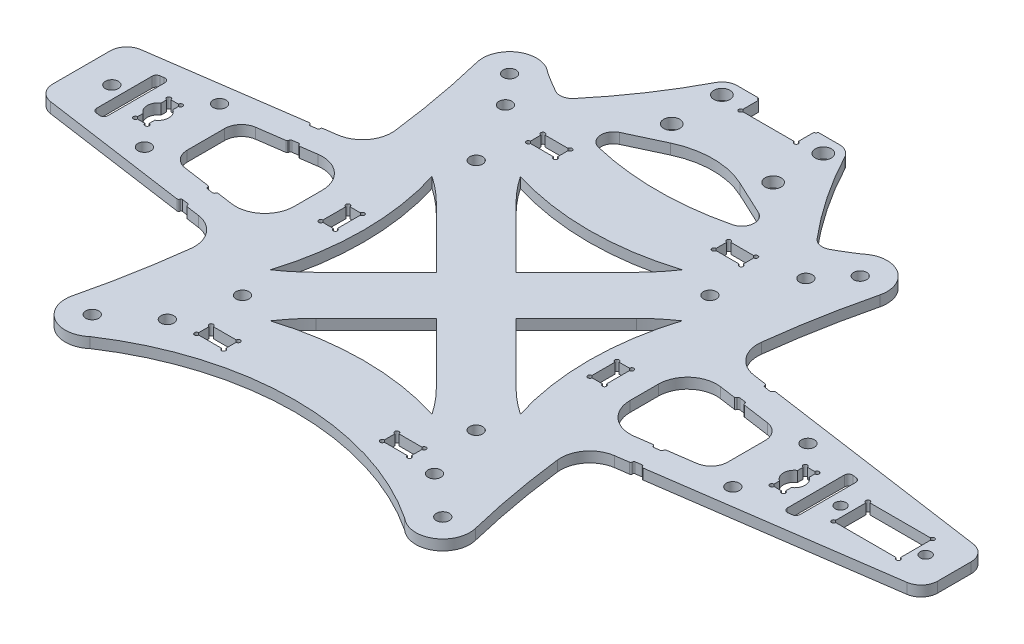
from build123d import *

# Parameters (mm, degrees)
SKETCH_1_R             = 1.55
SKETCH_1_R_2           = 1.3
SKETCH_1_W             = 6.5
SKETCH_1_H             = 3.5
SKETCH_1_W_2           = 3.5
SKETCH_1_H_2           = 6.5
SKETCH_1_W_3           = 15.5
SKETCH_1_H_3           = 8.2
EXTRUDE_1_DEPTH        = 2.5
FILLET_1_R             = 4
FILLET_2_R             = 7
CUT_EXTRUDE_3_DEPTH    = 128.770204339
FILLET_5_R             = 0.35
FILLET_4_R             = 1
SKETCH_6823_R          = 1.55
SKETCH_6823_R_2        = 1.925
EXTRUDE_2_DEPTH        = 2.5
SKETCH_10_R            = 0.5
CUT_EXTRUDE_6_DEPTH    = 137.857877785
SKETCH_11_R            = 1.55
CUT_EXTRUDE_9096_DEPTH = 137.857877785
FILLET_6_R             = 3


with BuildPart() as part:
    # 草图1 → 凸台-拉伸1 (new body)
    with BuildSketch(Plane(origin=(0, 0, 0), x_dir=(1, 0, 0), z_dir=(0, 1, 0))):
        with BuildLine():
            Line((114.591143215, 7.468307572), (114.591143215, -7.468307572))
            Line((114.591143215, -7.468307572), (43.193640968, -17.646273029))
            ThreePointArc((43.193640968, -17.646273029), (45.143245402, -33.15226541), (48.27557779, -48.463217404))
            ThreePointArc((48.27557779, -48.463217404), (45.335063646, -55.533708325), (37.709796983, -54.831018053))
            ThreePointArc((37.709796983, -54.831018053), (0, -43.436211003), (-37.709796983, -54.831018053))
            ThreePointArc((-37.709796983, -54.831018053), (-45.335063646, -55.533708325), (-48.27557779, -48.463217404))
            ThreePointArc((-48.27557779, -48.463217404), (-45.143245402, -33.15226541), (-43.193640968, -17.646273029))
            Line((-43.193640968, -17.646273029), (-94.579518436, -10.321035179))
            Line((-94.579518436, -10.321035179), (-94.579518436, 10.321035179))
            Line((-94.579518436, 10.321035179), (-43.193640968, 17.646273029))
            ThreePointArc((-43.193640968, 17.646273029), (-45.143245402, 33.15226541), (-48.27557779, 48.463217404))
            ThreePointArc((-48.27557779, 48.463217404), (-45.335063646, 55.533708325), (-37.709796983, 54.831018053))
            ThreePointArc((-37.709796983, 54.831018053), (0, 43.436211003), (37.709796983, 54.831018053))
            ThreePointArc((37.709796983, 54.831018053), (45.335063646, 55.533708325), (48.27557779, 48.463217404))
            ThreePointArc((48.27557779, 48.463217404), (45.143245402, 33.15226541), (43.193640968, 17.646273029))
            Line((43.193640968, 17.646273029), (114.591143215, 7.468307572))
        make_face()
        with Locations(Location((-36, 43, 0), (0, 0, 270))):
            Circle(SKETCH_1_R, mode=Mode.SUBTRACT)
        with Locations(Location((-32, -42, 0), (0, 0, 270))):
            Circle(SKETCH_1_R, mode=Mode.SUBTRACT)
        with Locations(Location((32, -42, 0), (0, 0, 90))):
            Circle(SKETCH_1_R, mode=Mode.SUBTRACT)
        with Locations(Location((36, 43, 0), (0, 0, 90))):
            Circle(SKETCH_1_R, mode=Mode.SUBTRACT)
        with Locations(Location((42, 50, 0), (0, 0, 270))):
            Circle(SKETCH_1_R, mode=Mode.SUBTRACT)
        with Locations(Location((42, -50, 0), (0, 0, 90))):
            Circle(SKETCH_1_R, mode=Mode.SUBTRACT)
        with Locations(Location((-42, -50, 0), (0, 0, 270))):
            Circle(SKETCH_1_R, mode=Mode.SUBTRACT)
        with Locations(Location((-42, 50, 0), (0, 0, 90))):
            Circle(SKETCH_1_R, mode=Mode.SUBTRACT)
        with Locations(Location((107.7, 0, 0), (0, 0, 270))):
            Circle(SKETCH_1_R_2, mode=Mode.SUBTRACT)
        with Locations(Location((87.3, 0, 0), (0, 0, 270))):
            Circle(SKETCH_1_R_2, mode=Mode.SUBTRACT)
        with Locations(Location((70.5, 9, 0), (0, 0, 270))):
            Circle(SKETCH_1_R, mode=Mode.SUBTRACT)
        with Locations(Location((70.5, -9, 0), (0, 0, 90))):
            Circle(SKETCH_1_R, mode=Mode.SUBTRACT)
        with Locations(Location((-70.5, -9, 0), (0, 0, 270))):
            Circle(SKETCH_1_R, mode=Mode.SUBTRACT)
        with Locations(Location((-70.5, 9, 0), (0, 0, 90))):
            Circle(SKETCH_1_R, mode=Mode.SUBTRACT)
        with Locations(Location((-87.3, 0, 0), (0, 0, 270))):
            Circle(SKETCH_1_R, mode=Mode.SUBTRACT)
        with Locations((-22.25, 39.75)):
            Rectangle(SKETCH_1_W, SKETCH_1_H, mode=Mode.SUBTRACT)
        with Locations((-32.25, 0)):
            Rectangle(SKETCH_1_W_2, SKETCH_1_H_2, mode=Mode.SUBTRACT)
        with Locations((-22.25, -39.75)):
            Rectangle(SKETCH_1_W, SKETCH_1_H, mode=Mode.SUBTRACT)
        with Locations((22.25, 39.75)):
            Rectangle(SKETCH_1_W, SKETCH_1_H, mode=Mode.SUBTRACT)
        with Locations((22.25, -39.75)):
            Rectangle(SKETCH_1_W, SKETCH_1_H, mode=Mode.SUBTRACT)
        with Locations((32.25, 0)):
            Rectangle(SKETCH_1_W_2, SKETCH_1_H_2, mode=Mode.SUBTRACT)
        with BuildLine():
            Line((77.65, -2.151778405), (77.65, -4))
            Line((77.65, -4), (74.85, -4))
            Line((74.85, -4), (74.85, -2.176778405))
            ThreePointArc((74.85, -2.176778405), (73.652957971, 0), (74.85, 2.176778405))
            Line((74.85, 2.176778405), (74.85, 4))
            Line((74.85, 4), (77.65, 4))
            Line((77.65, 4), (77.65, 2.151778405))
            ThreePointArc((77.65, 2.151778405), (78.8083942, 0), (77.65, -2.151778405))
        make_face(mode=Mode.SUBTRACT)
        with Locations((97.5, 0)):
            Rectangle(SKETCH_1_W_3, SKETCH_1_H_3, mode=Mode.SUBTRACT)
        with BuildLine():
            Line((-74.85, -2.176778405), (-74.85, -4))
            Line((-74.85, -4), (-77.65, -4))
            Line((-77.65, -4), (-77.65, -2.151778405))
            ThreePointArc((-77.65, -2.151778405), (-78.8083942, 0), (-77.65, 2.151778405))
            Line((-77.65, 2.151778405), (-77.65, 4))
            Line((-77.65, 4), (-74.85, 4))
            Line((-74.85, 4), (-74.85, 2.176778405))
            ThreePointArc((-74.85, 2.176778405), (-73.652957971, 0), (-74.85, -2.176778405))
        make_face(mode=Mode.SUBTRACT)
        with BuildLine():
            Line((-23.978041684, 14.429581723), (-9.54845996, 0))
            Line((-9.54845996, 0), (-23.978041684, -14.429581723))
            ThreePointArc((-23.978041684, -14.429581723), (-26.851664039, -17.042325553), (-29.960234119, -19.370614155))
            ThreePointArc((-29.960234119, -19.370614155), (-27.006361348, 0), (-29.960234119, 19.370614155))
            ThreePointArc((-29.960234119, 19.370614155), (-26.851664039, 17.042325553), (-23.978041684, 14.429581723))
        make_face(mode=Mode.SUBTRACT)
        with BuildLine():
            Line((14.429581723, 23.978041684), (0, 9.54845996))
            Line((0, 9.54845996), (-14.429581723, 23.978041684))
            ThreePointArc((-14.429581723, 23.978041684), (-17.042325553, 26.851664039), (-19.370614155, 29.960234119))
            ThreePointArc((-19.370614155, 29.960234119), (0, 27.006361348), (19.370614155, 29.960234119))
            ThreePointArc((19.370614155, 29.960234119), (17.042325553, 26.851664039), (14.429581723, 23.978041684))
        make_face(mode=Mode.SUBTRACT)
        with BuildLine():
            Line((23.978041684, -14.429581723), (9.54845996, 0))
            Line((9.54845996, 0), (23.978041684, 14.429581723))
            ThreePointArc((23.978041684, 14.429581723), (26.851664039, 17.042325553), (29.960234119, 19.370614155))
            ThreePointArc((29.960234119, 19.370614155), (27.006361348, 0), (29.960234119, -19.370614155))
            ThreePointArc((29.960234119, -19.370614155), (26.851664039, -17.042325553), (23.978041684, -14.429581723))
        make_face(mode=Mode.SUBTRACT)
        with BuildLine():
            Line((-14.429581723, -23.978041684), (0, -9.54845996))
            Line((0, -9.54845996), (14.429581723, -23.978041684))
            ThreePointArc((14.429581723, -23.978041684), (17.042325553, -26.851664039), (19.370614155, -29.960234119))
            ThreePointArc((19.370614155, -29.960234119), (0, -27.006361348), (-19.370614155, -29.960234119))
            ThreePointArc((-19.370614155, -29.960234119), (-17.042325553, -26.851664039), (-14.429581723, -23.978041684))
        make_face(mode=Mode.SUBTRACT)
        Polygon((-64.75, -7.957119899), (-64.75, 7.957119899), (-40.25, 11.449681205), (-40.25, -11.449681205), align=None, mode=Mode.SUBTRACT)
        Polygon((64.75, 7.957119899), (40.25, 11.449681205), (40.25, -11.449681205), (64.75, -7.957119899), align=None, mode=Mode.SUBTRACT)
        Polygon((84.3, 7.543714683), (81.4, 7.957119899), (81.4, -7.957119899), (84.3, -7.543714683), align=None, mode=Mode.SUBTRACT)
        Polygon((-84.3, 7.543714683), (-84.3, -7.543714683), (-81.4, -7.957119899), (-81.4, 7.957119899), align=None, mode=Mode.SUBTRACT)
    extrude(amount=EXTRUDE_1_DEPTH)

    # 圆角1
    fillet_1_edges = [part.edges().sort_by_distance(p)[0] for p in [
        (-64.75, 1.25, -7.957119899),
        (-64.75, 1.25, 7.957119899),
        (64.75, 1.25, 7.957119899),
        (64.75, 1.25, -7.957119899),
        (114.591143215, 1.25, -7.468307572),
        (114.591143215, 1.25, 7.468307572),
        (-94.579518436, 1.25, 10.321035179),
        (-94.579518436, 1.25, -10.321035179),
    ]]
    fillet(fillet_1_edges, radius=FILLET_1_R)

    # 圆角2
    fillet_2_edges = [part.edges().sort_by_distance(p)[0] for p in [
        (-40.25, 1.25, -11.449681205),
        (-40.25, 1.25, 11.449681205),
        (40.25, 1.25, -11.449681205),
        (40.25, 1.25, 11.449681205),
        (-43.193640968, 1.25, -17.646273029),
        (43.193640968, 1.25, -17.646273029),
        (43.193640968, 1.25, 17.646273029),
        (-43.193640968, 1.25, 17.646273029),
    ]]
    fillet(fillet_2_edges, radius=FILLET_2_R)

    # 草图6 → 切除-拉伸3 (cut, through all)
    with BuildSketch(Plane(origin=(0, 2.5, 0), x_dir=(1, 0, 0), z_dir=(0, 1, 0))):
        Polygon((53.295953363, 16.20615281), (55.637277294, 15.872388836), (55.245478476, 15.271669864), (53.295953363, 15.549581537), align=None)
        Polygon((54.504562879, 10.074214326), (52.555037767, 10.352125998), (52.371572952, 9.72170828), (54.712896883, 9.387944306), align=None)
        Polygon((52.555037767, -10.352125998), (52.371572952, -9.72170828), (54.712896883, -9.387944306), (54.504562879, -10.074214326), align=None)
        Polygon((53.295953363, -15.549581537), (53.295953363, -16.20615281), (55.637277294, -15.872388836), (55.245478476, -15.271669864), align=None)
        Polygon((-53.295953363, -16.20615281), (-55.637277294, -15.872388836), (-55.245478476, -15.271669864), (-53.295953363, -15.549581537), align=None)
        Polygon((-54.504562879, -10.074214326), (-52.555037767, -10.352125998), (-52.371572952, -9.72170828), (-54.712896883, -9.387944306), align=None)
        Polygon((-52.555037767, 10.352125998), (-52.371572952, 9.72170828), (-54.712896883, 9.387944306), (-54.504562879, 10.074214326), align=None)
        Polygon((-53.295953363, 15.549581537), (-53.295953363, 16.20615281), (-55.637277294, 15.872388836), (-55.245478476, 15.271669864), align=None)
    extrude(amount=-CUT_EXTRUDE_3_DEPTH, mode=Mode.SUBTRACT)

    # 圆角5
    fillet_5_edges = [part.edges().sort_by_distance(p)[0] for p in [
        (54.504562879, 1.25, -10.074214326),
        (54.712896883, 1.25, -9.387944306),
        (52.371572952, 1.25, -9.72170828),
        (52.555037767, 1.25, -10.352125998),
        (54.504562879, 1.25, 10.074214326),
        (52.555037767, 1.25, 10.352125998),
        (52.371572952, 1.25, 9.72170828),
        (54.712896883, 1.25, 9.387944306),
        (53.295953363, 1.25, 15.549581537),
        (55.245478476, 1.25, 15.271669864),
        (55.637277294, 1.25, 15.872388836),
        (53.295953363, 1.25, 16.20615281),
        (-53.295953363, 1.25, 15.549581537),
        (-53.295953363, 1.25, 16.20615281),
        (-55.637277294, 1.25, 15.872388836),
        (-55.245478476, 1.25, 15.271669864),
        (-54.504562879, 1.25, 10.074214326),
        (-54.712896883, 1.25, 9.387944306),
        (-52.371572952, 1.25, 9.72170828),
        (-52.555037767, 1.25, 10.352125998),
        (-54.504562879, 1.25, -10.074214326),
        (-52.555037767, 1.25, -10.352125998),
        (-52.371572952, 1.25, -9.72170828),
        (-54.712896883, 1.25, -9.387944306),
        (-53.295953363, 1.25, -15.549581537),
        (-55.245478476, 1.25, -15.271669864),
        (-55.637277294, 1.25, -15.872388836),
        (-53.295953363, 1.25, -16.20615281),
        (53.295953363, 1.25, -15.549581537),
        (53.295953363, 1.25, -16.20615281),
        (55.637277294, 1.25, -15.872388836),
        (55.245478476, 1.25, -15.271669864),
    ]]
    fillet(fillet_5_edges, radius=FILLET_5_R)

    # 圆角4
    fillet_4_edges = [part.edges().sort_by_distance(p)[0] for p in [
        (84.3, 1.25, 7.543714683),
        (84.3, 1.25, -7.543714683),
        (81.4, 1.25, -7.957119899),
        (81.4, 1.25, 7.957119899),
        (-81.4, 1.25, -7.957119899),
        (-84.3, 1.25, -7.543714683),
        (-84.3, 1.25, 7.543714683),
        (-81.4, 1.25, 7.957119899),
    ]]
    fillet(fillet_4_edges, radius=FILLET_4_R)

    # Sketch 6823 → 凸台-拉伸2 (add)
    with BuildSketch(Plane(origin=(0, 0, 0), x_dir=(1, 0, 0), z_dir=(0, 1, 0))):
        with BuildLine():
            Line((31.186148385, 48.469650162), (30.681262847, 50.739792213))
            ThreePointArc((30.681262847, 50.739792213), (22.441462835, 61.322620143), (15.49564557, 72.796336793))
            ThreePointArc((15.49564557, 72.796336793), (14.299946524, 74.143040297), (12.617082358, 74.784347349))
            Line((12.617082358, 74.784347349), (11.682917642, 74.784347349))
            Line((11.682917642, 74.784347349), (6.65, 74.784347349))
            Line((6.65, 74.784347349), (6.65, 70.034347349))
            Line((6.65, 70.034347349), (0.15, 70.034347349))
            Line((0.15, 70.034347349), (-0.15, 70.034347349))
            Line((-0.15, 70.034347349), (-6.65, 70.034347349))
            Line((-6.65, 70.034347349), (-6.65, 74.784347349))
            Line((-6.65, 74.784347349), (-11.682917642, 74.784347349))
            Line((-11.682917642, 74.784347349), (-12.617082358, 74.784347349))
            ThreePointArc((-12.617082358, 74.784347349), (-14.299946524, 74.143040297), (-15.49564557, 72.796336793))
            ThreePointArc((-15.49564557, 72.796336793), (-22.441462835, 61.322620143), (-30.681262847, 50.739792213))
            Line((-30.681262847, 50.739792213), (-31.186148385, 48.469650162))
            ThreePointArc((-31.186148385, 48.469650162), (-33.809409468, 47.529800488), (-36.537837525, 46.963676424))
            ThreePointArc((-36.537837525, 46.963676424), (-39.218080485, 40.624298421), (-32.370509151, 41.318692124))
            ThreePointArc((-32.370509151, 41.318692124), (-31.135199663, 43.325028618), (-29.464750167, 44.986646546))
            Line((-29.464750167, 44.986646546), (-8.309564026, 54.881414672))
            ThreePointArc((-8.309564026, 54.881414672), (0, 56.728666289), (8.309564026, 54.881414672))
            Line((8.309564026, 54.881414672), (29.464750167, 44.986646546))
            ThreePointArc((29.464750167, 44.986646546), (31.135199663, 43.325028618), (32.370509151, 41.318692124))
            ThreePointArc((32.370509151, 41.318692124), (39.218080485, 40.624298421), (36.537837525, 46.963676424))
            ThreePointArc((36.537837525, 46.963676424), (33.809409468, 47.529800488), (31.186148385, 48.469650162))
        make_face()
        with Locations(Location((-36, 43, 0), (0, 0, 270))):
            Circle(SKETCH_6823_R, mode=Mode.SUBTRACT)
        with Locations(Location((36, 43, 0), (0, 0, 90))):
            Circle(SKETCH_6823_R, mode=Mode.SUBTRACT)
        with Locations(Location((-12.15, 59, 0), (0, 0, 270))):
            Circle(SKETCH_6823_R_2, mode=Mode.SUBTRACT)
        with Locations(Location((-12.15, 71.03, 0), (0, 0, 270))):
            Circle(SKETCH_6823_R_2, mode=Mode.SUBTRACT)
        with Locations(Location((12.15, 59, 0), (0, 0, 270))):
            Circle(SKETCH_6823_R_2, mode=Mode.SUBTRACT)
        with Locations(Location((12.15, 71.03, 0), (0, 0, 270))):
            Circle(SKETCH_6823_R_2, mode=Mode.SUBTRACT)
    extrude(amount=EXTRUDE_2_DEPTH)

    # 草图10 → 切除-拉伸6 (cut, through all)
    with BuildSketch(Plane(origin=(0, 0, 0), x_dir=(1, 0, 0), z_dir=(0, 1, 0))):
        with Locations((-77.65, 4)):
            Circle(SKETCH_10_R)
        with Locations((-74.85, 4)):
            Circle(SKETCH_10_R)
        with Locations((-77.65, -4)):
            Circle(SKETCH_10_R)
        with Locations((-74.85, -4)):
            Circle(SKETCH_10_R)
        with Locations((-25.5, 41.5)):
            Circle(SKETCH_10_R)
        with Locations((-19, 41.5)):
            Circle(SKETCH_10_R)
        with Locations((-25.5, 38)):
            Circle(SKETCH_10_R)
        with Locations((-19, 38)):
            Circle(SKETCH_10_R)
        with Locations((-34, 3.25)):
            Circle(SKETCH_10_R)
        with Locations((-30.5, 3.25)):
            Circle(SKETCH_10_R)
        with Locations((-34, -3.25)):
            Circle(SKETCH_10_R)
        with Locations((-30.5, -3.25)):
            Circle(SKETCH_10_R)
        with Locations((-25.5, -38)):
            Circle(SKETCH_10_R)
        with Locations((-19, -38)):
            Circle(SKETCH_10_R)
        with Locations((-25.5, -41.5)):
            Circle(SKETCH_10_R)
        with Locations((-19, -41.5)):
            Circle(SKETCH_10_R)
        with Locations((19, -41.5)):
            Circle(SKETCH_10_R)
        with Locations((25.5, -41.5)):
            Circle(SKETCH_10_R)
        with Locations((19, -38)):
            Circle(SKETCH_10_R)
        with Locations((25.5, -38)):
            Circle(SKETCH_10_R)
        with Locations((30.5, -3.25)):
            Circle(SKETCH_10_R)
        with Locations((34, -3.25)):
            Circle(SKETCH_10_R)
        with Locations((30.5, 3.25)):
            Circle(SKETCH_10_R)
        with Locations((34, 3.25)):
            Circle(SKETCH_10_R)
        with Locations((19, 38)):
            Circle(SKETCH_10_R)
        with Locations((25.5, 38)):
            Circle(SKETCH_10_R)
        with Locations((19, 41.5)):
            Circle(SKETCH_10_R)
        with Locations((25.5, 41.5)):
            Circle(SKETCH_10_R)
        with Locations((74.85, -4)):
            Circle(SKETCH_10_R)
        with Locations((77.65, -4)):
            Circle(SKETCH_10_R)
        with Locations((74.85, 4)):
            Circle(SKETCH_10_R)
        with Locations((77.65, 4)):
            Circle(SKETCH_10_R)
        with Locations((89.75, 4.1)):
            Circle(SKETCH_10_R)
        with Locations((105.25, 4.1)):
            Circle(SKETCH_10_R)
        with Locations((89.75, -4.1)):
            Circle(SKETCH_10_R)
        with Locations((105.25, -4.1)):
            Circle(SKETCH_10_R)
        with Locations((-6.65, 70.034347349)):
            Circle(SKETCH_10_R)
        with Locations((6.65, 70.034347349)):
            Circle(SKETCH_10_R)
        with Locations((-6.65, 74.784347349)):
            Circle(SKETCH_10_R)
        with Locations((6.65, 74.784347349)):
            Circle(SKETCH_10_R)
    extrude(amount=CUT_EXTRUDE_6_DEPTH, mode=Mode.SUBTRACT)

    # 草图11 → Cut-Extrude 9096 (cut, through all)
    with BuildSketch(Plane.XZ):
        with Locations(Location((28, -28, 0), (0, 0, 270))):
            Circle(SKETCH_11_R)
        with Locations(Location((-28, -28, 0), (0, 0, 270))):
            Circle(SKETCH_11_R)
        with Locations(Location((-28, 28, 0), (0, 0, 270))):
            Circle(SKETCH_11_R)
        with Locations(Location((28, 28, 0), (0, 0, 270))):
            Circle(SKETCH_11_R)
    extrude(amount=-CUT_EXTRUDE_9096_DEPTH, mode=Mode.SUBTRACT)

    # 圆角6
    fillet_6_edges = [part.edges().sort_by_distance(p)[0] for p in [
        (-23.687333986, 1.25, -47.688877247),
        (23.687333986, 1.25, -47.688877247),
        (30.681262847, 1.25, -50.739792213),
        (-30.681262847, 1.25, -50.739792213),
    ]]
    fillet(fillet_6_edges, radius=FILLET_6_R)


solid = part.part
